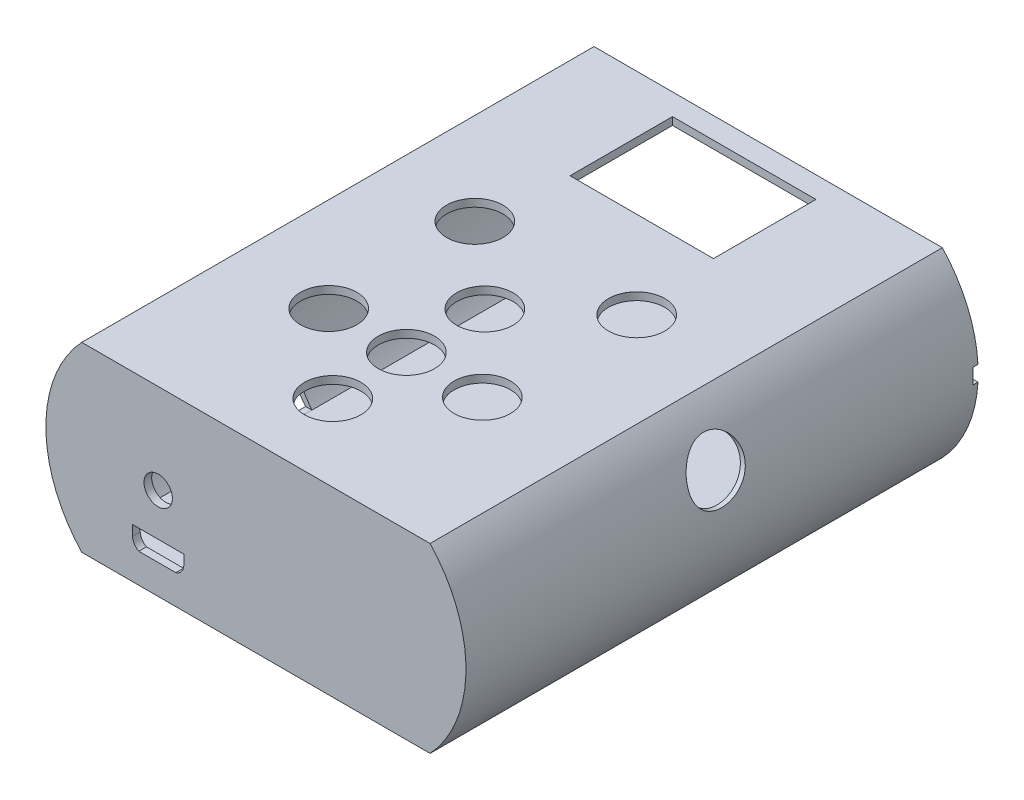
from build123d import *

# Parameters (mm, degrees)
BOSS_EXTRUDE6_DEPTH      = 100
BOSS_EXTRUDE6_DEPTH_BACK = 0.001
SKETCH18_R               = 2.767750359
BOSS_EXTRUDE9_DEPTH      = 1.5
BUTTONS_R                = 5.5
BUTTONS_W                = 28
BUTTONS_H                = 20
BUTTON_AND_SCREEN_DEPTH  = 6
SKETCH19_R               = 5.5
SKETCH19_W               = 1
SKETCH19_H               = 3
SIDE_BUTTON_DEPTH        = 5
SKETCH21_W               = 13
SKETCH21_H               = 3
SKETCH21_W_2             = 1
SD_DEPTH                 = 10


with BuildPart() as part:
    # Sketch11 → Boss-Extrude6 (new, two sides: drawn at the far end of the back side and taken through both)
    with BuildSketch(Plane.XY.offset(-BOSS_EXTRUDE6_DEPTH_BACK)):
        with BuildLine():
            Line((12.090473059, 31.438385701), (-55.909526941, 31.438385701))
            ThreePointArc((-55.909526941, 31.438385701), (-62.909525951, 13.690145961), (-55.909524961, -4.058092998))
            Line((-55.909524961, -4.058092998), (12.090475039, -4.058092998))
            ThreePointArc((12.090475039, -4.058092998), (19.090474049, 13.690146742), (12.090473059, 31.438385701))
        make_face()
        with BuildLine():
            ThreePointArc((-55.982181155, -2.559853672), (-61.409525951, 13.690146159), (-55.982182167, 29.940146328))
            Line((-55.982182167, 29.940146328), (12.017817833, 29.940146328))
            ThreePointArc((12.017817833, 29.940146328), (18.182401791, 13.69014652), (12.017818845, -2.559853672))
            Line((12.017818845, -2.559853672), (-55.982181155, -2.559853672))
        make_face(mode=Mode.SUBTRACT)
    extrude(amount=BOSS_EXTRUDE6_DEPTH + BOSS_EXTRUDE6_DEPTH_BACK)

    # Sketch18 → Boss-Extrude9 (add)
    with BuildSketch(Plane.XY.offset(100)):
        with BuildLine():
            Line((-56.430997181, 30.863154166), (11.569002819, 30.863154166))
            ThreePointArc((11.569002819, 30.863154166), (18.451770949, 13.909743201), (11.943724122, -3.19101605))
            Line((11.943724122, -3.19101605), (-56.056275878, -3.19101605))
            ThreePointArc((-56.056275878, -3.19101605), (-61.923208926, 13.773572842), (-56.430997181, 30.863154166))
        make_face()
        with Locations((-40.987099535, 13.863154166)):
            Circle(SKETCH18_R, mode=Mode.SUBTRACT)
        with BuildLine():
            Line((-45.987099535, 5.599250189), (-35.987099535, 5.599250189))
            Line((-35.987099535, 5.599250189), (-35.987099535, 3.599250189))
            ThreePointArc((-35.987099535, 3.599250189), (-36.45964853, 2.401250061), (-37.530763976, 1.686254566))
            Line((-37.530763976, 1.686254566), (-44.777500495, 1.686254566))
            ThreePointArc((-44.777500495, 1.686254566), (-45.637915591, 2.481125057), (-45.987099535, 3.599250189))
            Line((-45.987099535, 3.599250189), (-45.987099535, 5.599250189))
        make_face(mode=Mode.SUBTRACT)
    extrude(amount=-BOSS_EXTRUDE9_DEPTH)

    # Buttons → button_and_screen (cut)
    with BuildSketch(Plane(origin=(0, 31.438385701, 0), x_dir=(-1, 0, 0), z_dir=(0, -1, 0))):
        with Locations((21.909526941, -85)):
            Circle(BUTTONS_R)
        with Locations((22.524996564, -70.012632081)):
            Circle(BUTTONS_R)
        with Locations((7.525921137, -70.179174321)):
            Circle(BUTTONS_R)
        with Locations((37.524071992, -70.179174321)):
            Circle(BUTTONS_R)
        with Locations((22.202955863, -55.016089486)):
            Circle(BUTTONS_R)
        with Locations((37.999783984, -41.179174321)):
            Circle(BUTTONS_R)
        with Locations((6.406127741, -41.179174321)):
            Circle(BUTTONS_R)
        with Locations((22.412844998, -14.179174321)):
            Rectangle(BUTTONS_W, BUTTONS_H)
    extrude(amount=BUTTON_AND_SCREEN_DEPTH, mode=Mode.SUBTRACT)

    # Sketch19 → side button (cut)
    with BuildSketch(Plane(origin=(19.090474049, 0, 0), x_dir=(0, 0, -1), z_dir=(1, 0, 0))):
        with Locations((-50, 21.438385701)):
            Circle(SKETCH19_R)
        with Locations((-0.499, 13.688385701)):
            Rectangle(SKETCH19_W, SKETCH19_H)
    extrude(amount=-SIDE_BUTTON_DEPTH, mode=Mode.SUBTRACT)

    # Sketch21 → sd (cut)
    with BuildSketch(Plane.ZY.offset(62.909525951)):
        with Locations((61.5, -1.058092998)):
            Rectangle(SKETCH21_W, SKETCH21_H)
        with Locations((0.499, 13.688385701)):
            Rectangle(SKETCH21_W_2, SKETCH21_H)
    extrude(amount=-SD_DEPTH, mode=Mode.SUBTRACT)


solid = part.part
